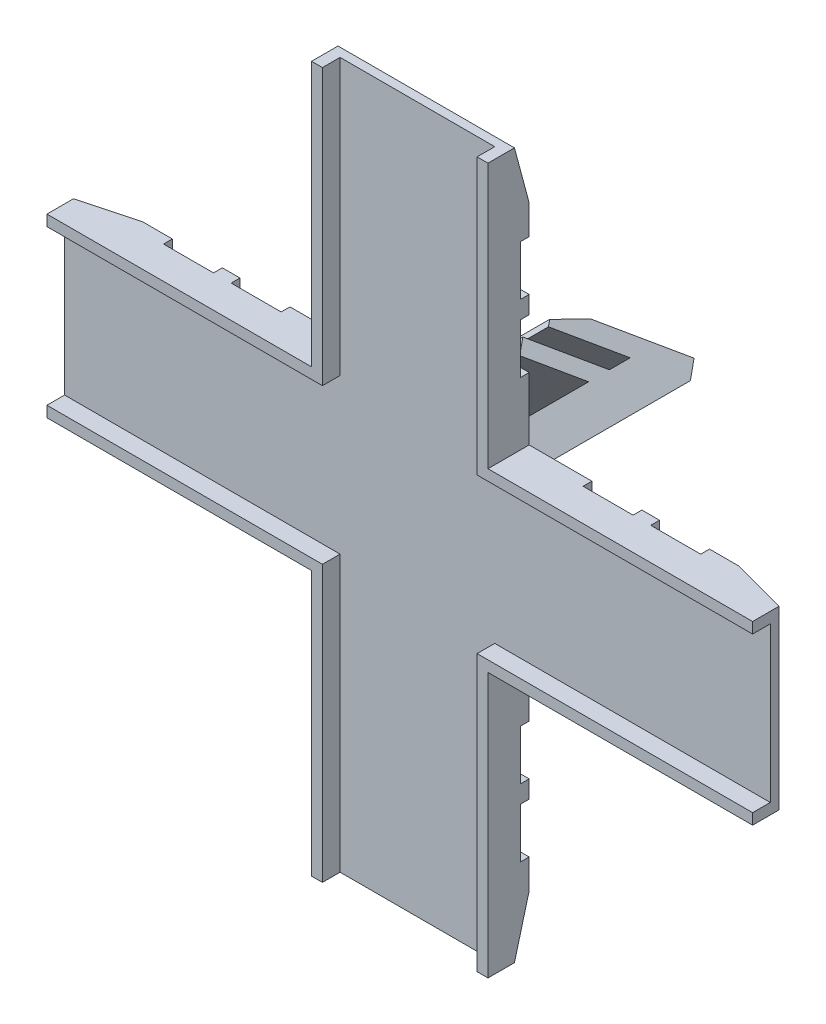
from build123d import *
from OCP.BRepFilletAPI import BRepFilletAPI_MakeChamfer

# Parameters (mm, degrees)
SKETCH1_W           = 1.85
SKETCH1_H           = 38.85
SKETCH1_H_2         = 6.15
SKETCH1_W_2         = 44.85
SKETCH1_H_3         = 1.85
SKETCH1_W_3         = 0.15
BOSS_EXTRUDE1_DEPTH = 3
SKETCH1_4_W         = 120
SKETCH1_4_H         = 30
SKETCH1_4_W_2       = 30
SKETCH1_4_H_2       = 120
BOSS_EXTRUDE3_DEPTH = 4
CHAMFER1_SIZE       = 2.5
CHAMFER1_SIZE2      = 9.330127019
SKETCH4_W           = 8.5
SKETCH4_H           = 30
SKETCH4_W_2         = 30
SKETCH4_H_2         = 8.5
CUT_EXTRUDE1_DEPTH  = 1.5
BOSS_EXTRUDE4_DEPTH = 35
CHAMFER2_SIZE       = 6
BOSS_EXTRUDE5_DEPTH = 3
CHAMFER3_SIZE       = 2
CHAMFER3_SIZE2      = 5.494954839
BOSS_EXTRUDE6_DEPTH = 2.5


with BuildPart() as part:
    # Sketch1 → Boss-Extrude1 (new body)
    with BuildSketch(Plane(origin=(0, 0, 0), x_dir=(-1, 0, 0), z_dir=(0, 0, -1))):
        with Locations((14.075, 40.575)):
            Rectangle(SKETCH1_W, SKETCH1_H)
        with Locations((14.075, 18.075)):
            Rectangle(SKETCH1_W, SKETCH1_H_2)
        with Locations((37.575, 14.075)):
            Rectangle(SKETCH1_W_2, SKETCH1_H_3)
        with Locations((14.075, 14.075)):
            Rectangle(SKETCH1_W, SKETCH1_H_3)
        with Locations((14.075, -14.075)):
            Rectangle(SKETCH1_W, SKETCH1_H_3)
        with Locations((14.075, -18.075)):
            Rectangle(SKETCH1_W, SKETCH1_H_2)
        with Locations((37.575, -14.075)):
            Rectangle(SKETCH1_W_2, SKETCH1_H_3)
        with Locations((14.075, -40.575)):
            Rectangle(SKETCH1_W, SKETCH1_H)
        with Locations((-14.075, -14.075)):
            Rectangle(SKETCH1_W, SKETCH1_H_3)
        with Locations((-14.075, -18.075)):
            Rectangle(SKETCH1_W, SKETCH1_H_2)
        with Locations((-37.575, -14.075)):
            Rectangle(SKETCH1_W_2, SKETCH1_H_3)
        with Locations((-15.075, -14.075)):
            Rectangle(SKETCH1_W_3, SKETCH1_H_3)
        with Locations((15.075, -14.075)):
            Rectangle(SKETCH1_W_3, SKETCH1_H_3)
        with Locations((15.075, 14.075)):
            Rectangle(SKETCH1_W_3, SKETCH1_H_3)
        with Locations((-37.575, 14.075)):
            Rectangle(SKETCH1_W_2, SKETCH1_H_3)
        with Locations((-15.075, 14.075)):
            Rectangle(SKETCH1_W_3, SKETCH1_H_3)
        with Locations((-14.075, 18.075)):
            Rectangle(SKETCH1_W, SKETCH1_H_2)
        with Locations((-14.075, 14.075)):
            Rectangle(SKETCH1_W, SKETCH1_H_3)
        with Locations((-14.075, 40.575)):
            Rectangle(SKETCH1_W, SKETCH1_H)
        with Locations((-14.075, -40.575)):
            Rectangle(SKETCH1_W, SKETCH1_H)
    extrude(amount=-BOSS_EXTRUDE1_DEPTH)

    # Sketch1<4> → Boss-Extrude3 (add)
    with BuildSketch(Plane(origin=(0, 0, 0), x_dir=(-1, 0, 0), z_dir=(0, 0, -1))):
        Rectangle(SKETCH1_4_W, SKETCH1_4_H)
        Rectangle(SKETCH1_4_W_2, SKETCH1_4_H_2)
    extrude(amount=BOSS_EXTRUDE3_DEPTH)

    # Chamfer1: one chamfer whose edges measure the first distance from different faces: ONE call of the kernel's chamfer builder (chamfer() names one face for all edges)
    chamfer1_edges_1 = [part.edges().sort_by_distance(p)[0] for p in [
        (60, 0, -4),
    ]]
    chamfer1_side_1 = [part.faces().sort_by_distance(p)[0] for p in [
        (60, 0, -1.703661327),
    ]]
    chamfer1_edges_2 = [part.edges().sort_by_distance(p)[0] for p in [
        (0, 60, -4),
    ]]
    chamfer1_side_2 = [part.faces().sort_by_distance(p)[0] for p in [
        (0, 60, -1.703661327),
    ]]
    chamfer1_edges_3 = [part.edges().sort_by_distance(p)[0] for p in [
        (0, -60, -4),
    ]]
    chamfer1_side_3 = [part.faces().sort_by_distance(p)[0] for p in [
        (0, -60, -1.703661327),
    ]]
    chamfer1_edges_4 = [part.edges().sort_by_distance(p)[0] for p in [
        (-60, 0, -4),
    ]]
    chamfer1_side_4 = [part.faces().sort_by_distance(p)[0] for p in [
        (-60, 0, -1.703661327),
    ]]
    chamfer1 = BRepFilletAPI_MakeChamfer(part.part.solid().wrapped)
    for e in chamfer1_edges_1:
        chamfer1.Add(CHAMFER1_SIZE, CHAMFER1_SIZE2, e.wrapped, chamfer1_side_1[0].wrapped)  # the first distance lies on this face
    for e in chamfer1_edges_2:
        chamfer1.Add(CHAMFER1_SIZE, CHAMFER1_SIZE2, e.wrapped, chamfer1_side_2[0].wrapped)  # the first distance lies on this face
    for e in chamfer1_edges_3:
        chamfer1.Add(CHAMFER1_SIZE, CHAMFER1_SIZE2, e.wrapped, chamfer1_side_3[0].wrapped)  # the first distance lies on this face
    for e in chamfer1_edges_4:
        chamfer1.Add(CHAMFER1_SIZE, CHAMFER1_SIZE2, e.wrapped, chamfer1_side_4[0].wrapped)  # the first distance lies on this face
    add(Compound.cast(chamfer1.Shape()), mode=Mode.REPLACE)

    # Sketch4 → Cut-Extrude1 (cut)
    with BuildSketch(Plane(origin=(0, 0, -4), x_dir=(-1, 0, 0), z_dir=(0, 0, -1))):
        with Locations((-41.419872981, 0)):
            Rectangle(SKETCH4_W, SKETCH4_H)
        with Locations((-29.919872981, 0)):
            Rectangle(SKETCH4_W, SKETCH4_H)
        with Locations((0, 41.419872981)):
            Rectangle(SKETCH4_W_2, SKETCH4_H_2)
        with Locations((0, 29.919872981)):
            Rectangle(SKETCH4_W_2, SKETCH4_H_2)
        with Locations((29.919872981, 0)):
            Rectangle(SKETCH4_W, SKETCH4_H)
        with Locations((41.419872981, 0)):
            Rectangle(SKETCH4_W, SKETCH4_H)
        with Locations((0, -29.919872981)):
            Rectangle(SKETCH4_W_2, SKETCH4_H_2)
        with Locations((0, -41.419872981)):
            Rectangle(SKETCH4_W_2, SKETCH4_H_2)
    extrude(amount=-CUT_EXTRUDE1_DEPTH, mode=Mode.SUBTRACT)

    # Sketch5 → Boss-Extrude4 (add)
    with BuildSketch(Plane(origin=(0, 0, -4), x_dir=(-1, 0, 0), z_dir=(0, 0, -1))):
        Polygon((-7.424621202, 3.181980515), (-3.181980515, 7.424621202), (7.424621202, -3.181980515), (3.181980515, -7.424621202), align=None)
    extrude(amount=BOSS_EXTRUDE4_DEPTH)

    # Chamfer2
    chamfer2_edges = [part.edges().sort_by_distance(p)[0] for p in [
        (-2.121320344, 2.121320344, -39),
    ]]
    chamfer(chamfer2_edges, length=CHAMFER2_SIZE - 0.0001)  # a hair under: the kernel refuses the full size

    # Sketch6 → Boss-Extrude5 (add)
    with BuildSketch(Plane(origin=(-12.727922061, 12.727922061, -18), x_dir=(-0.8660254037844379, -0.28867513459481464, 0.4082482904638634), z_dir=(-0.5000000000000013, 0.5000000000000013, -0.7071067811865458))):
        Polygon((-23.270152556, -19.918584287), (-11.723147173, -3.588652668), (0.524301541, -12.248906706), (-11.022703843, -28.578838325), align=None)
    extrude(amount=BOSS_EXTRUDE5_DEPTH)

    # Chamfer3
    chamfer3_edges = [part.edges().sort_by_distance(p)[0] for p in [
        (-9.378679656, 9.378679656, -26.97918472),
    ]]
    chamfer3_side = [part.faces().sort_by_distance(p)[0] for p in [
        (-8.628679656, 8.628679656, -25.918524548),
    ]]
    chamfer(chamfer3_edges, length=CHAMFER3_SIZE, length2=CHAMFER3_SIZE2, reference=chamfer3_side[0])

    # Sketch8 → Boss-Extrude6 (add)
    with BuildSketch(Plane(origin=(-11.477922061, 11.477922061, -16.232233047), x_dir=(0.8660254037844378, 0.28867513459481475, -0.4082482904638635), z_dir=(0.5000000000000016, -0.5000000000000013, 0.7071067811865456))):
        Polygon((6.123724357, -21.650635095), (18.371173071, -12.990381057), (9.885891697, -0.990381057), (-2.361557017, -9.650635095), align=None)
    extrude(amount=BOSS_EXTRUDE6_DEPTH)


solid = part.part
